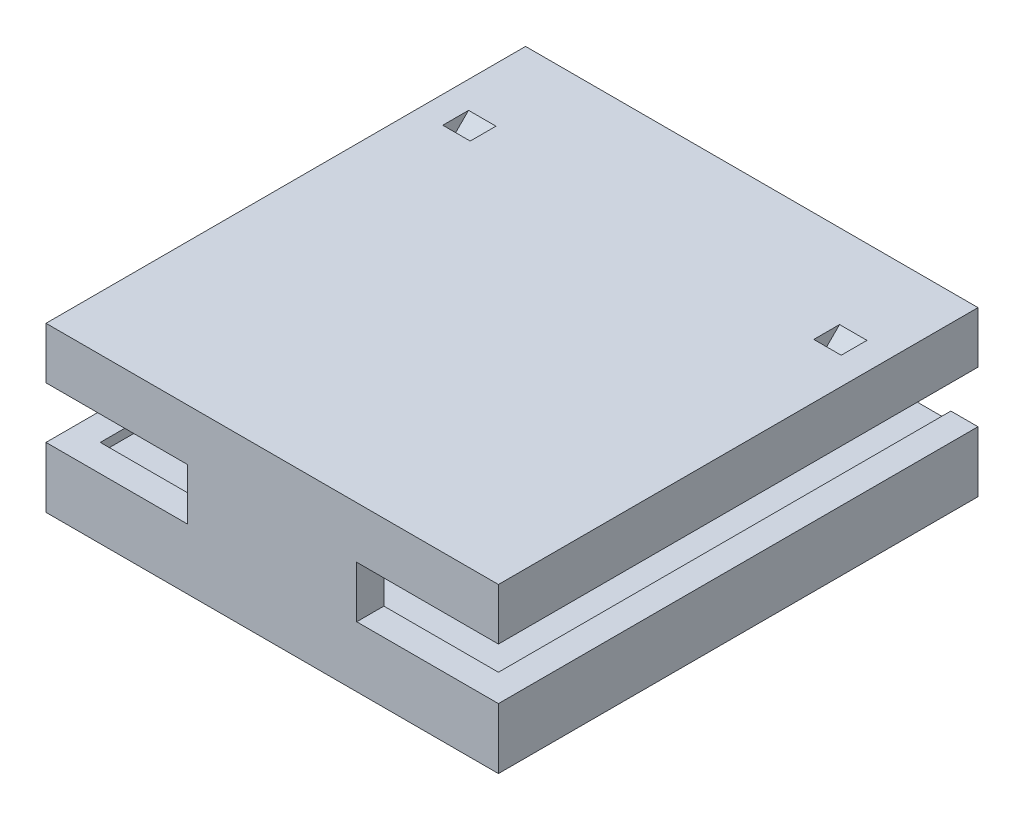
from build123d import *

# Parameters (mm, degrees)
SKETCH1_W           = 9.34
SKETCH1_H           = 3.35
SKETCH1_W_2         = 1.5
SKETCH1_H_2         = 0.5
SKETCH1_W_3         = 6.33
BOSS_EXTRUDE1_DEPTH = 1.5
SKETCH1_6_W         = 1.5
SKETCH1_6_H         = 0.5
BOSS_EXTRUDE4_DEPTH = 25
CAVITY1_START       = -11.015
CAVITY1_DEPTH       = 1.515
CAVITY1_START_2     = 9.485
CAVITY1_2_DEPTH     = 1.515


# Read off the part's stored shape, not the designer's step: Cavity1
with BuildPart() as part:
    # Sketch1 → Boss-Extrude1 (new body)
    with BuildSketch(Plane.XY):
        Rectangle(SKETCH1_W, SKETCH1_H)
        Polygon((11, -1.675), (4.67, -1.675), (-4.67, -1.675), (-11, -1.675), (-12.5, -1.675), (-12.5, -4.525), (12.5, -4.525), (12.5, -1.675), align=None)
        Polygon((-4.67, 1.675), (4.67, 1.675), (12.5, 1.675), (12.5, 4.525), (-12.5, 4.525), (-12.5, 1.675), align=None)
        with Locations((11.75, -1.425)):
            Rectangle(SKETCH1_W_2, SKETCH1_H_2)
        with Locations((7.835, -1.425)):
            Rectangle(SKETCH1_W_3, SKETCH1_H_2)
        with Locations((-11.75, -1.425)):
            Rectangle(SKETCH1_W_2, SKETCH1_H_2)
        with Locations((-7.835, -1.425)):
            Rectangle(SKETCH1_W_3, SKETCH1_H_2)
    extrude(amount=BOSS_EXTRUDE1_DEPTH)

    # Sketch1<6> → Boss-Extrude4 (add)
    with BuildSketch(Plane.XY):
        Polygon((11, -1.675), (4.67, -1.675), (-4.67, -1.675), (-11, -1.675), (-12.5, -1.675), (-12.5, -4.525), (12.5, -4.525), (12.5, -1.675), align=None)
        Polygon((-4.67, 1.675), (4.67, 1.675), (12.5, 1.675), (12.5, 4.525), (-12.5, 4.525), (-12.5, 1.675), align=None)
        with Locations((11.75, -1.425)):
            Rectangle(SKETCH1_6_W, SKETCH1_6_H)
        with Locations((-11.75, -1.425)):
            Rectangle(SKETCH1_6_W, SKETCH1_6_H)
    extrude(amount=-BOSS_EXTRUDE4_DEPTH)

    # Cavity1 outline → Cavity1 (cut)
    with BuildSketch(Plane.YZ.offset(CAVITY1_START)):
        Polygon((-4.525, -18.94), (-4.525, -20.455), (-3.01, -18.94), align=None)
        Polygon((4.525, -18.94), (3.1005, -18.94), (4.525, -20.3645), align=None)
    extrude(amount=CAVITY1_DEPTH, mode=Mode.SUBTRACT)

    # Cavity1 2 outline → Cavity1 2 (cut)
    with BuildSketch(Plane.YZ.offset(CAVITY1_START_2)):
        Polygon((-4.525, -18.94), (-4.525, -20.455), (-3.01, -18.94), align=None)
        Polygon((4.525, -18.94), (3.1005, -18.94), (4.525, -20.3645), align=None)
    extrude(amount=CAVITY1_2_DEPTH, mode=Mode.SUBTRACT)


solid = part.part
